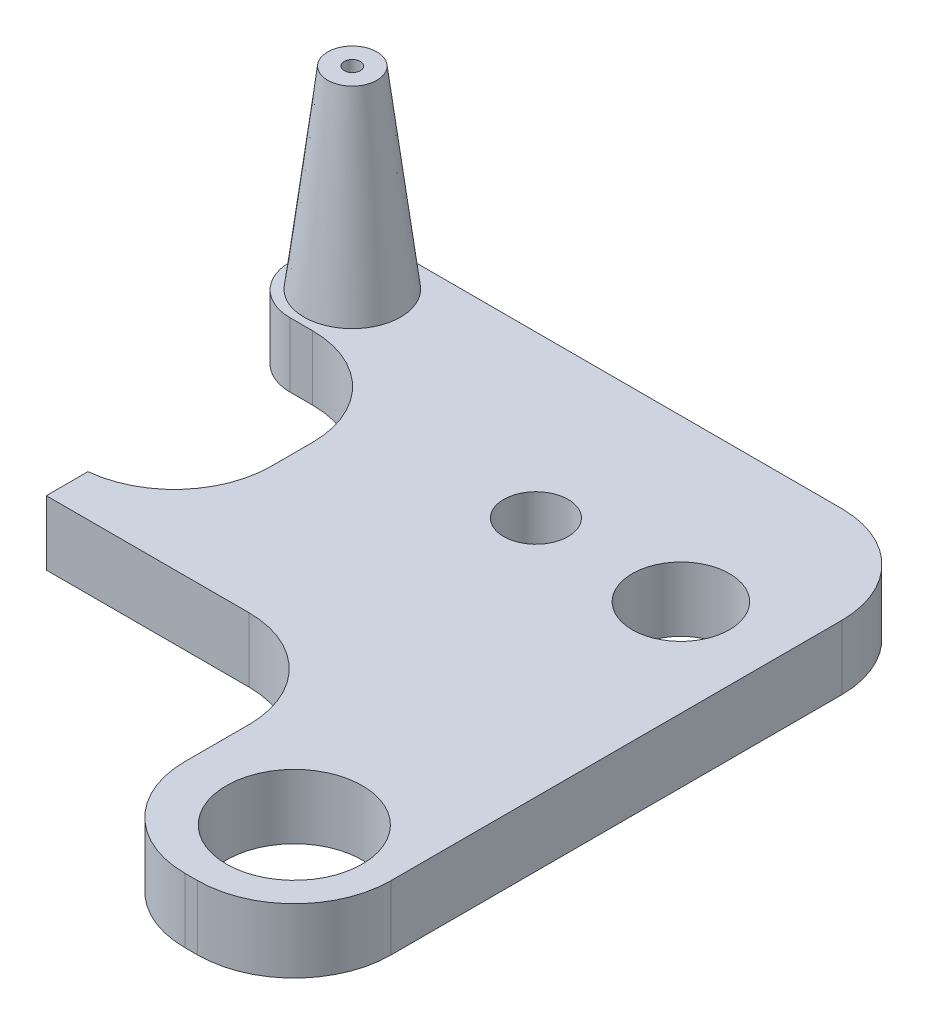
from build123d import *

# Parameters (mm, degrees)
SKETCH1_R           = 7.55
SKETCH1_R_2         = 5
SKETCH1_R_3         = 10.55
BOSS_EXTRUDE1_DEPTH = 10
SKETCH2_R           = 1.25
CUT_EXTRUDE1_DEPTH  = 10
SKETCH4_R           = 7.5
BOSS_EXTRUDE2_DEPTH = 30
BOSS_EXTRUDE2_TAPER = 7
SKETCH5_R           = 1.25
CUT_EXTRUDE2_DEPTH  = 10
FILLET1_R           = 15
FILLET2_R           = 7.5


with BuildPart() as part:
    # Sketch1 → Boss-Extrude1 (new body)
    with BuildSketch(Plane(origin=(0, 0, 0), x_dir=(1, 0, 0), z_dir=(0, 1, 0))):
        Polygon((23.995878661, -35), (56.995878661, -35), (56.995878661, -75), (88.995878661, -75), (88.995878661, -25), (88.995878661, 25), (17.5, 25), (-2.004121339, 25), (-2.004121339, 7.840472806), (23.995878661, 7.840472806), (23.995878661, 0), (23.995878661, -28.53803828), (10.495878661, -28.53803828), (10.495878661, -35), align=None)
        with Locations(Location((73.995878661, 0, 0), (0, 0, 270))):
            Circle(SKETCH1_R, mode=Mode.SUBTRACT)
        with Locations(Location((51.495878661, 0, 0), (0, 0, 270))):
            Circle(SKETCH1_R_2, mode=Mode.SUBTRACT)
        with Locations(Location((73.995878661, -60, 0), (0, 0, 270))):
            Circle(SKETCH1_R_3, mode=Mode.SUBTRACT)
    extrude(amount=BOSS_EXTRUDE1_DEPTH)

    # Sketch2 → Cut-Extrude1 (cut)
    with BuildSketch(Plane.ZY.offset(-10.495878661)):
        with Locations((31.76901914, 5)):
            Circle(SKETCH2_R)
    extrude(amount=-CUT_EXTRUDE1_DEPTH, mode=Mode.SUBTRACT)

    # Sketch4 → Boss-Extrude2 (add)
    with BuildSketch(Plane(origin=(0, 10, 0), x_dir=(1, 0, 0), z_dir=(0, 1, 0))):
        with Locations((6.495878661, 16.5)):
            Circle(SKETCH4_R)
    extrude(amount=BOSS_EXTRUDE2_DEPTH, taper=BOSS_EXTRUDE2_TAPER)

    # Sketch5 → Cut-Extrude2 (cut)
    with BuildSketch(Plane(origin=(0, 40, 0), x_dir=(1, 0, 0), z_dir=(0, 1, 0))):
        with Locations(Location((6.495878661, 16.5, 0), (0, 0, 270))):
            Circle(SKETCH5_R)
    extrude(amount=-CUT_EXTRUDE2_DEPTH, mode=Mode.SUBTRACT)

    # Fillet1
    # the kernel refuses this fillet: 15 mm, written as the material it adds along each edge
    with BuildSketch(Plane(origin=(56.995878661, 0, 35), x_dir=(-1, 0, 0), z_dir=(0, 1, 0)), Plane(origin=(23.995878661, 0, -7.840472806), x_dir=(-1, 0, 0), z_dir=(0, 1, 0))) as fillet1_piece_1:
        with BuildLine():
            CenterArc((FILLET1_R, FILLET1_R), FILLET1_R, 180, 90)
            Line((0, FILLET1_R), (0, 0))
            Line((0, 0), (FILLET1_R, 0))
        make_face()
    extrude(amount=10)
    with BuildSketch(Plane(origin=(23.995878661, 0, 28.53803828), x_dir=(0, 0, -1), z_dir=(0, 1, 0))) as fillet1_piece_2:
        with BuildLine():
            CenterArc((14.924811557, 15), FILLET1_R, 185.739170477, 84.260829523)
            Line((0, 13.5), (0, 0))
            Line((0, 0), (14.924811557, 0))
        make_face()
    extrude(amount=10)
    # the kernel refuses this fillet: 15 mm, written as the material it takes off along each edge
    with BuildSketch(Plane(origin=(88.995878661, -37.5, -25), x_dir=(0, 0, 1), z_dir=(0, 1, 0)), Plane(origin=(88.995878661, -37.5, 75), x_dir=(-1, 0, 0), z_dir=(0, 1, 0)), Plane(origin=(56.995878661, -37.5, 75), x_dir=(0, 0, -1), z_dir=(0, 1, 0))) as fillet1_2_piece_1:
        with BuildLine():
            CenterArc((FILLET1_R, -FILLET1_R), FILLET1_R, 90, 90)
            Line((0, -FILLET1_R), (0, 0))
            Line((0, 0), (FILLET1_R, 0))
        make_face()
    extrude(amount=85, mode=Mode.SUBTRACT)

    # Fillet2
    fillet2_edges = [part.edges().sort_by_distance(p)[0] for p in [
        (-2.004121339, 5, -7.840472806),
        (-2.004121339, 5, -25),
    ]]
    fillet(fillet2_edges, radius=FILLET2_R)


solid = part.part
